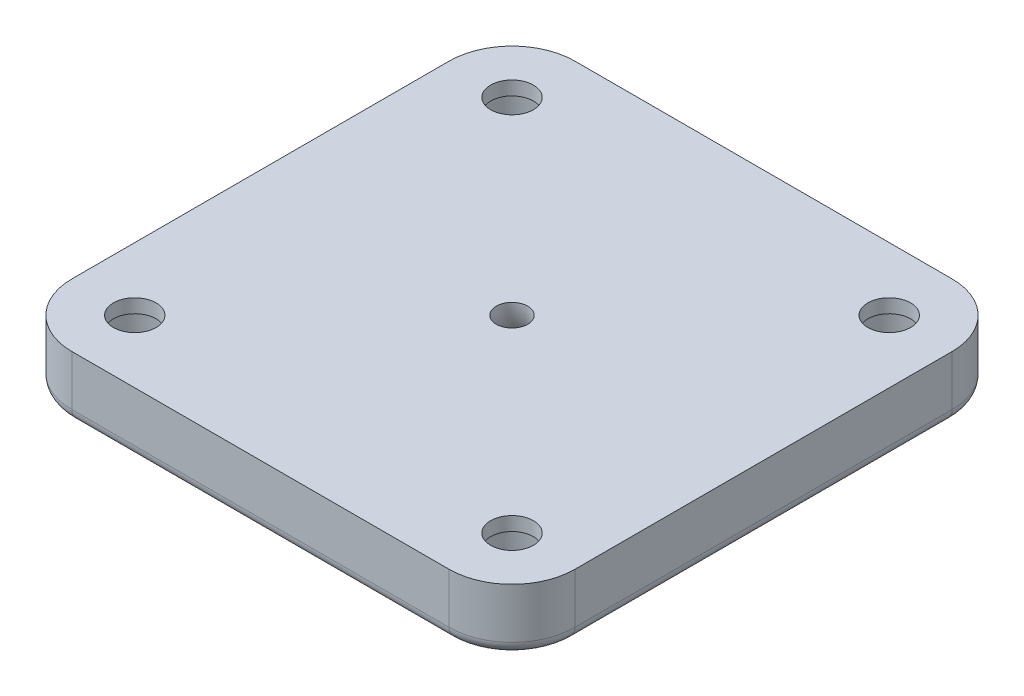
from build123d import *

# Parameters (mm, degrees)
BOSS_EXTRUDE1_DEPTH          = 5
SKETCH1_3_R                  = 1.7
SKETCH1_3_R_2                = 1.25
CUT_EXTRUDE3_DEPTH           = 29.722813233
CUT_EXTRUDE4_START           = 5
SKETCH1_4_R                  = 2.6
CUT_EXTRUDE4_DEPTH           = 3.9
CUT_EXTRUDE4_DRAFT           = -1.5
CUT_EXTRUDE4_PROFILE_2_DEPTH = 3.9
CUT_EXTRUDE4_PROFILE_2_DRAFT = -1.5
CUT_EXTRUDE4_PROFILE_3_DEPTH = 3.9
CUT_EXTRUDE4_PROFILE_3_DRAFT = -1.5
CUT_EXTRUDE4_PROFILE_4_DEPTH = 3.9
CUT_EXTRUDE4_PROFILE_4_DRAFT = -1.5
FILLET1_R                    = 5
FILLET2_R                    = 1


with BuildPart() as part:
    # Sketch1 → Boss-Extrude1 (new body)
    with BuildSketch(Plane(origin=(0, -7, 0), x_dir=(-1, 0, 0), z_dir=(0, -1, 0))):
        with BuildLine():
            Line((15, 20), (-15, 20))
            ThreePointArc((-15, 20), (-18.535533906, 18.535533906), (-20, 15))
            Line((-20, 15), (-20, -15))
            ThreePointArc((-20, -15), (-18.535533906, -18.535533906), (-15, -20))
            Line((-15, -20), (15, -20))
            ThreePointArc((15, -20), (18.535533906, -18.535533906), (20, -15))
            Line((20, -15), (20, 15))
            ThreePointArc((20, 15), (18.535533906, 18.535533906), (15, 20))
        make_face()
    extrude(amount=BOSS_EXTRUDE1_DEPTH)

    # Sketch1<3> → Cut-Extrude3 (cut, through all)
    with BuildSketch(Plane(origin=(0, -7, 0), x_dir=(-1, 0, 0), z_dir=(0, -1, 0))):
        with Locations(Location((-15, 15, 0), (0, 0, 90))):
            Circle(SKETCH1_3_R)
        with Locations(Location((15, 15, 0), (0, 0, 90))):
            Circle(SKETCH1_3_R)
        with Locations(Location((-15, -15, 0), (0, 0, 90))):
            Circle(SKETCH1_3_R)
        with Locations(Location((15, -15, 0), (0, 0, 90))):
            Circle(SKETCH1_3_R)
        with Locations(Location((0, 0, 0), (0, 0, 90))):
            Circle(SKETCH1_3_R_2)
    extrude(amount=CUT_EXTRUDE3_DEPTH, mode=Mode.SUBTRACT)


with BuildPart() as cut_extrude4_tool:
    # Sketch1<4> → Cut-Extrude4 (with draft: the straight prism first)
    with BuildSketch(Plane(origin=(0, -7, 0), x_dir=(-1, 0, 0), z_dir=(0, -1, 0)).offset(CUT_EXTRUDE4_START)):
        with Locations((15, -15)):
            Circle(SKETCH1_4_R)
    extrude(amount=-CUT_EXTRUDE4_DEPTH)
    # Cut-Extrude4: the draft: its side faces are tilted about the plane it starts from
    cut_extrude4_sides = [cut_extrude4_tool.faces().sort_by_distance(p)[0] for p in [
        (-12.4, -10.05, 15),
    ]]
    draft(cut_extrude4_sides, Plane(origin=(0, -7, 0), x_dir=(-1, 0, 0), z_dir=(0, -1, 0)).offset(CUT_EXTRUDE4_START), CUT_EXTRUDE4_DRAFT)


with BuildPart() as part_1:
    add(part.part)

    # Cut-Extrude4: cut by cut_extrude4_tool
    add(cut_extrude4_tool.part, mode=Mode.SUBTRACT)


with BuildPart() as cut_extrude4_profile_2_tool:
    # Sketch1<4> → Cut-Extrude4 profile 2 (with draft: the straight prism first)
    with BuildSketch(Plane(origin=(0, -7, 0), x_dir=(-1, 0, 0), z_dir=(0, -1, 0)).offset(CUT_EXTRUDE4_START)):
        with Locations((-15, -15)):
            Circle(SKETCH1_4_R)
    extrude(amount=-CUT_EXTRUDE4_PROFILE_2_DEPTH)
    # Cut-Extrude4 profile 2: the draft: its side faces are tilted about the plane it starts from
    cut_extrude4_profile_2_sides = [cut_extrude4_profile_2_tool.faces().sort_by_distance(p)[0] for p in [
        (17.6, -10.05, 15),
    ]]
    draft(cut_extrude4_profile_2_sides, Plane(origin=(0, -7, 0), x_dir=(-1, 0, 0), z_dir=(0, -1, 0)).offset(CUT_EXTRUDE4_START), CUT_EXTRUDE4_PROFILE_2_DRAFT)


with BuildPart() as part_2:
    add(part_1.part)

    # Cut-Extrude4 profile 2: cut by cut_extrude4_profile_2_tool
    add(cut_extrude4_profile_2_tool.part, mode=Mode.SUBTRACT)


with BuildPart() as cut_extrude4_profile_3_tool:
    # Sketch1<4> → Cut-Extrude4 profile 3 (with draft: the straight prism first)
    with BuildSketch(Plane(origin=(0, -7, 0), x_dir=(-1, 0, 0), z_dir=(0, -1, 0)).offset(CUT_EXTRUDE4_START)):
        with Locations((-15, 15)):
            Circle(SKETCH1_4_R)
    extrude(amount=-CUT_EXTRUDE4_PROFILE_3_DEPTH)
    # Cut-Extrude4 profile 3: the draft: its side faces are tilted about the plane it starts from
    cut_extrude4_profile_3_sides = [cut_extrude4_profile_3_tool.faces().sort_by_distance(p)[0] for p in [
        (17.6, -10.05, -15),
    ]]
    draft(cut_extrude4_profile_3_sides, Plane(origin=(0, -7, 0), x_dir=(-1, 0, 0), z_dir=(0, -1, 0)).offset(CUT_EXTRUDE4_START), CUT_EXTRUDE4_PROFILE_3_DRAFT)


with BuildPart() as part_3:
    add(part_2.part)

    # Cut-Extrude4 profile 3: cut by cut_extrude4_profile_3_tool
    add(cut_extrude4_profile_3_tool.part, mode=Mode.SUBTRACT)


with BuildPart() as cut_extrude4_profile_4_tool:
    # Sketch1<4> → Cut-Extrude4 profile 4 (with draft: the straight prism first)
    with BuildSketch(Plane(origin=(0, -7, 0), x_dir=(-1, 0, 0), z_dir=(0, -1, 0)).offset(CUT_EXTRUDE4_START)):
        with Locations((15, 15)):
            Circle(SKETCH1_4_R)
    extrude(amount=-CUT_EXTRUDE4_PROFILE_4_DEPTH)
    # Cut-Extrude4 profile 4: the draft: its side faces are tilted about the plane it starts from
    cut_extrude4_profile_4_sides = [cut_extrude4_profile_4_tool.faces().sort_by_distance(p)[0] for p in [
        (-12.4, -10.05, -15),
    ]]
    draft(cut_extrude4_profile_4_sides, Plane(origin=(0, -7, 0), x_dir=(-1, 0, 0), z_dir=(0, -1, 0)).offset(CUT_EXTRUDE4_START), CUT_EXTRUDE4_PROFILE_4_DRAFT)


with BuildPart() as part_4:
    add(part_3.part)

    # Cut-Extrude4 profile 4: cut by cut_extrude4_profile_4_tool
    add(cut_extrude4_profile_4_tool.part, mode=Mode.SUBTRACT)

    # Fillet1
    fillet1_edges = [part_4.edges().sort_by_distance(p)[0] for p in [
        (0, -12, 1.25),
    ]]
    fillet(fillet1_edges, radius=FILLET1_R - 0.0001)  # a hair under: the kernel refuses the full size

    # Fillet2
    fillet2_edges = [part_4.edges().sort_by_distance(p)[0] for p in [
        (-18.535533906, -12, 18.535533906),
        (-20, -12, 0),
        (-18.535533906, -12, -18.535533906),
        (0, -12, -20),
        (18.535533906, -12, -18.535533906),
        (20, -12, 0),
        (18.535533906, -12, 18.535533906),
        (0, -12, 20),
    ]]
    fillet(fillet2_edges, radius=FILLET2_R)


solid = part_4.part
